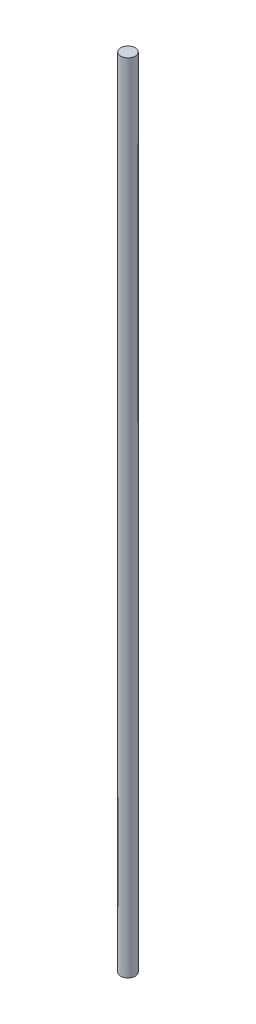
from build123d import *

# Parameters (mm, degrees)
SKETCH1_R           = 4.5
BOSS_EXTRUDE1_DEPTH = 494


with BuildPart() as part:
    # Sketch1 → Boss-Extrude1 (new body)
    with BuildSketch(Plane(origin=(0, 0, 0), x_dir=(1, 0, 0), z_dir=(0, 1, 0))):
        Circle(SKETCH1_R)
    extrude(amount=BOSS_EXTRUDE1_DEPTH)


solid = part.part
